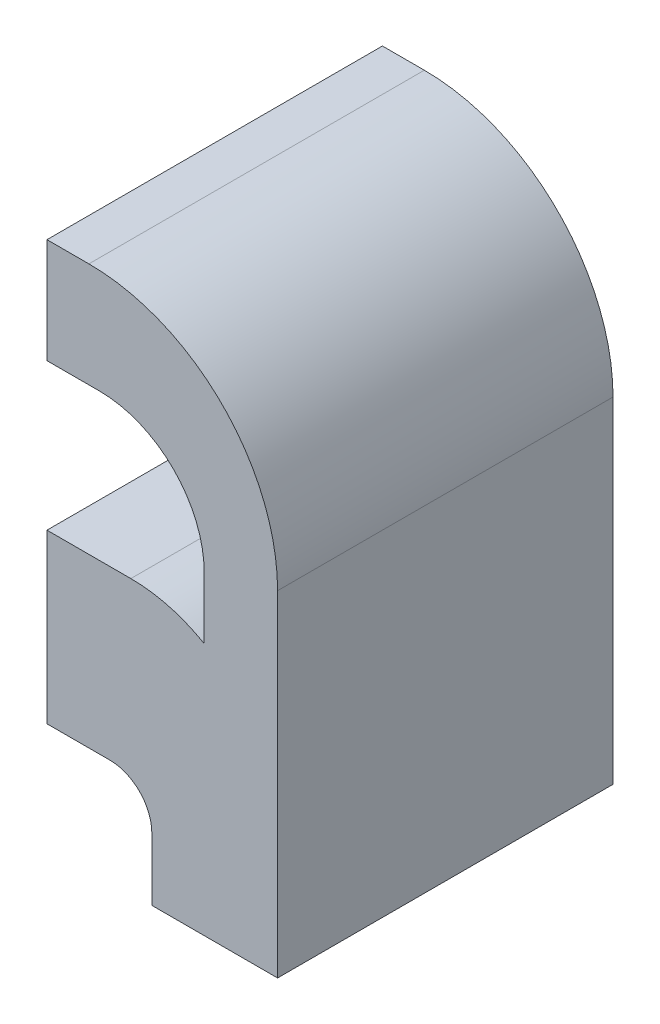
from build123d import *

# Parameters (mm, degrees)
BOSS_EXTRUDE1_DEPTH = 80
SKETCH2_R           = 2.5
CUT_EXTRUDE1_DEPTH  = 20
LPATTERN1_START     = -50
LPATTERN1_OUTLINE_R = 2.5
LPATTERN1_DEPTH     = 20
SKETCH3_W           = 154
SKETCH3_H           = 6
CUT_EXTRUDE2_DEPTH  = 20
LPATTERN2_COUNT     = 6
LPATTERN2_PITCH     = 7.6


# Read off the part's stored shape, not the designer's step: LPattern1
with BuildPart() as part:
    # Sketch1 → Boss-Extrude1 (new, symmetric)
    with BuildSketch(Plane.XY):
        with BuildLine():
            ThreePointArc((25, 120.621778265), (50.621778265, 95), (60, 60))
            Line((60, 60), (60, 160))
            ThreePointArc((60, 160), (33.639610307, 223.639610307), (-30, 250))
            Line((-30, 250), (-50, 250))
            Line((-50, 250), (-50, 200))
            Line((-50, 200), (-25, 200))
            ThreePointArc((-25, 200), (10.355339059, 185.355339059), (25, 150))
            Line((25, 150), (25, 120.621778265))
        make_face()
        with BuildLine():
            ThreePointArc((-10, 130), (39.497474683, 109.497474683), (60, 60))
            Line((60, 60), (60, 0))
            Line((60, 0), (0, 0))
            Line((0, 0), (0, 30))
            ThreePointArc((0, 30), (-5.857864376, 44.142135624), (-20, 50))
            Line((-20, 50), (-50, 50))
            Line((-50, 50), (-50, 130))
            Line((-50, 130), (-10, 130))
        make_face()
    extrude(amount=BOSS_EXTRUDE1_DEPTH, both=True)

    # Sketch2 → Cut-Extrude1 (cut)
    with BuildSketch(Plane.ZY.offset(50)):
        with Locations((-75, 125)):
            Circle(SKETCH2_R)
    extrude(amount=-CUT_EXTRUDE1_DEPTH, mode=Mode.SUBTRACT)

    # LPattern1 outline → LPattern1 (cut)
    with BuildSketch(Plane.YZ.offset(LPATTERN1_START)):
        with Locations((57, 73)):
            Circle(LPATTERN1_OUTLINE_R)
        with Locations((57, 66.565217391)):
            Circle(LPATTERN1_OUTLINE_R)
        with Locations((57, 60.130434783)):
            Circle(LPATTERN1_OUTLINE_R)
        with Locations((57, 53.695652174)):
            Circle(LPATTERN1_OUTLINE_R)
        with Locations((57, 47.260869565)):
            Circle(LPATTERN1_OUTLINE_R)
        with Locations((57, 40.826086957)):
            Circle(LPATTERN1_OUTLINE_R)
        with Locations((57, 34.391304348)):
            Circle(LPATTERN1_OUTLINE_R)
        with Locations((57, 27.956521739)):
            Circle(LPATTERN1_OUTLINE_R)
        with Locations((57, 21.52173913)):
            Circle(LPATTERN1_OUTLINE_R)
        with Locations((57, 15.086956522)):
            Circle(LPATTERN1_OUTLINE_R)
        with Locations((57, 8.652173913)):
            Circle(LPATTERN1_OUTLINE_R)
        with Locations((57, 2.217391304)):
            Circle(LPATTERN1_OUTLINE_R)
        with Locations((57, -4.217391304)):
            Circle(LPATTERN1_OUTLINE_R)
        with Locations((57, -10.652173913)):
            Circle(LPATTERN1_OUTLINE_R)
        with Locations((57, -17.086956522)):
            Circle(LPATTERN1_OUTLINE_R)
        with Locations((57, -23.52173913)):
            Circle(LPATTERN1_OUTLINE_R)
        with Locations((57, -29.956521739)):
            Circle(LPATTERN1_OUTLINE_R)
        with Locations((57, -36.391304348)):
            Circle(LPATTERN1_OUTLINE_R)
        with Locations((57, -42.826086957)):
            Circle(LPATTERN1_OUTLINE_R)
        with Locations((57, -49.260869565)):
            Circle(LPATTERN1_OUTLINE_R)
        with Locations((57, -55.695652174)):
            Circle(LPATTERN1_OUTLINE_R)
        with Locations((57, -62.130434783)):
            Circle(LPATTERN1_OUTLINE_R)
        with Locations((57, -68.565217391)):
            Circle(LPATTERN1_OUTLINE_R)
        with Locations((57, -75)):
            Circle(LPATTERN1_OUTLINE_R)
        with Locations((62.230769231, 73)):
            Circle(LPATTERN1_OUTLINE_R)
        with Locations((62.230769231, 66.565217391)):
            Circle(LPATTERN1_OUTLINE_R)
        with Locations((62.230769231, 60.130434783)):
            Circle(LPATTERN1_OUTLINE_R)
        with Locations((62.230769231, 53.695652174)):
            Circle(LPATTERN1_OUTLINE_R)
        with Locations((62.230769231, 47.260869565)):
            Circle(LPATTERN1_OUTLINE_R)
        with Locations((62.230769231, 40.826086957)):
            Circle(LPATTERN1_OUTLINE_R)
        with Locations((62.230769231, 34.391304348)):
            Circle(LPATTERN1_OUTLINE_R)
        with Locations((62.230769231, 27.956521739)):
            Circle(LPATTERN1_OUTLINE_R)
        with Locations((62.230769231, 21.52173913)):
            Circle(LPATTERN1_OUTLINE_R)
        with Locations((62.230769231, 15.086956522)):
            Circle(LPATTERN1_OUTLINE_R)
        with Locations((62.230769231, 8.652173913)):
            Circle(LPATTERN1_OUTLINE_R)
        with Locations((62.230769231, 2.217391304)):
            Circle(LPATTERN1_OUTLINE_R)
        with Locations((62.230769231, -4.217391304)):
            Circle(LPATTERN1_OUTLINE_R)
        with Locations((62.230769231, -10.652173913)):
            Circle(LPATTERN1_OUTLINE_R)
        with Locations((62.230769231, -17.086956522)):
            Circle(LPATTERN1_OUTLINE_R)
        with Locations((62.230769231, -23.52173913)):
            Circle(LPATTERN1_OUTLINE_R)
        with Locations((62.230769231, -29.956521739)):
            Circle(LPATTERN1_OUTLINE_R)
        with Locations((62.230769231, -36.391304348)):
            Circle(LPATTERN1_OUTLINE_R)
        with Locations((62.230769231, -42.826086957)):
            Circle(LPATTERN1_OUTLINE_R)
        with Locations((62.230769231, -49.260869565)):
            Circle(LPATTERN1_OUTLINE_R)
        with Locations((62.230769231, -55.695652174)):
            Circle(LPATTERN1_OUTLINE_R)
        with Locations((62.230769231, -62.130434783)):
            Circle(LPATTERN1_OUTLINE_R)
        with Locations((62.230769231, -68.565217391)):
            Circle(LPATTERN1_OUTLINE_R)
        with Locations((62.230769231, -75)):
            Circle(LPATTERN1_OUTLINE_R)
        with Locations((67.461538462, 73)):
            Circle(LPATTERN1_OUTLINE_R)
        with Locations((67.461538462, 66.565217391)):
            Circle(LPATTERN1_OUTLINE_R)
        with Locations((67.461538462, 60.130434783)):
            Circle(LPATTERN1_OUTLINE_R)
        with Locations((67.461538462, 53.695652174)):
            Circle(LPATTERN1_OUTLINE_R)
        with Locations((67.461538462, 47.260869565)):
            Circle(LPATTERN1_OUTLINE_R)
        with Locations((67.461538462, 40.826086957)):
            Circle(LPATTERN1_OUTLINE_R)
        with Locations((67.461538462, 34.391304348)):
            Circle(LPATTERN1_OUTLINE_R)
        with Locations((67.461538462, 27.956521739)):
            Circle(LPATTERN1_OUTLINE_R)
        with Locations((67.461538462, 21.52173913)):
            Circle(LPATTERN1_OUTLINE_R)
        with Locations((67.461538462, 15.086956522)):
            Circle(LPATTERN1_OUTLINE_R)
        with Locations((67.461538462, 8.652173913)):
            Circle(LPATTERN1_OUTLINE_R)
        with Locations((67.461538462, 2.217391304)):
            Circle(LPATTERN1_OUTLINE_R)
        with Locations((67.461538462, -4.217391304)):
            Circle(LPATTERN1_OUTLINE_R)
        with Locations((67.461538462, -10.652173913)):
            Circle(LPATTERN1_OUTLINE_R)
        with Locations((67.461538462, -17.086956522)):
            Circle(LPATTERN1_OUTLINE_R)
        with Locations((67.461538462, -23.52173913)):
            Circle(LPATTERN1_OUTLINE_R)
        with Locations((67.461538462, -29.956521739)):
            Circle(LPATTERN1_OUTLINE_R)
        with Locations((67.461538462, -36.391304348)):
            Circle(LPATTERN1_OUTLINE_R)
        with Locations((67.461538462, -42.826086957)):
            Circle(LPATTERN1_OUTLINE_R)
        with Locations((67.461538462, -49.260869565)):
            Circle(LPATTERN1_OUTLINE_R)
        with Locations((67.461538462, -55.695652174)):
            Circle(LPATTERN1_OUTLINE_R)
        with Locations((67.461538462, -62.130434783)):
            Circle(LPATTERN1_OUTLINE_R)
        with Locations((67.461538462, -68.565217391)):
            Circle(LPATTERN1_OUTLINE_R)
        with Locations((67.461538462, -75)):
            Circle(LPATTERN1_OUTLINE_R)
        with Locations((72.692307692, 73)):
            Circle(LPATTERN1_OUTLINE_R)
        with Locations((72.692307692, 66.565217391)):
            Circle(LPATTERN1_OUTLINE_R)
        with Locations((72.692307692, 60.130434783)):
            Circle(LPATTERN1_OUTLINE_R)
        with Locations((72.692307692, 53.695652174)):
            Circle(LPATTERN1_OUTLINE_R)
        with Locations((72.692307692, 47.260869565)):
            Circle(LPATTERN1_OUTLINE_R)
        with Locations((72.692307692, 40.826086957)):
            Circle(LPATTERN1_OUTLINE_R)
        with Locations((72.692307692, 34.391304348)):
            Circle(LPATTERN1_OUTLINE_R)
        with Locations((72.692307692, 27.956521739)):
            Circle(LPATTERN1_OUTLINE_R)
        with Locations((72.692307692, 21.52173913)):
            Circle(LPATTERN1_OUTLINE_R)
        with Locations((72.692307692, 15.086956522)):
            Circle(LPATTERN1_OUTLINE_R)
        with Locations((72.692307692, 8.652173913)):
            Circle(LPATTERN1_OUTLINE_R)
        with Locations((72.692307692, 2.217391304)):
            Circle(LPATTERN1_OUTLINE_R)
        with Locations((72.692307692, -4.217391304)):
            Circle(LPATTERN1_OUTLINE_R)
        with Locations((72.692307692, -10.652173913)):
            Circle(LPATTERN1_OUTLINE_R)
        with Locations((72.692307692, -17.086956522)):
            Circle(LPATTERN1_OUTLINE_R)
        with Locations((72.692307692, -23.52173913)):
            Circle(LPATTERN1_OUTLINE_R)
        with Locations((72.692307692, -29.956521739)):
            Circle(LPATTERN1_OUTLINE_R)
        with Locations((72.692307692, -36.391304348)):
            Circle(LPATTERN1_OUTLINE_R)
        with Locations((72.692307692, -42.826086957)):
            Circle(LPATTERN1_OUTLINE_R)
        with Locations((72.692307692, -49.260869565)):
            Circle(LPATTERN1_OUTLINE_R)
        with Locations((72.692307692, -55.695652174)):
            Circle(LPATTERN1_OUTLINE_R)
        with Locations((72.692307692, -62.130434783)):
            Circle(LPATTERN1_OUTLINE_R)
        with Locations((72.692307692, -68.565217391)):
            Circle(LPATTERN1_OUTLINE_R)
        with Locations((72.692307692, -75)):
            Circle(LPATTERN1_OUTLINE_R)
        with Locations((77.923076923, 73)):
            Circle(LPATTERN1_OUTLINE_R)
        with Locations((77.923076923, 66.565217391)):
            Circle(LPATTERN1_OUTLINE_R)
        with Locations((77.923076923, 60.130434783)):
            Circle(LPATTERN1_OUTLINE_R)
        with Locations((77.923076923, 53.695652174)):
            Circle(LPATTERN1_OUTLINE_R)
        with Locations((77.923076923, 47.260869565)):
            Circle(LPATTERN1_OUTLINE_R)
        with Locations((77.923076923, 40.826086957)):
            Circle(LPATTERN1_OUTLINE_R)
        with Locations((77.923076923, 34.391304348)):
            Circle(LPATTERN1_OUTLINE_R)
        with Locations((77.923076923, 27.956521739)):
            Circle(LPATTERN1_OUTLINE_R)
        with Locations((77.923076923, 21.52173913)):
            Circle(LPATTERN1_OUTLINE_R)
        with Locations((77.923076923, 15.086956522)):
            Circle(LPATTERN1_OUTLINE_R)
        with Locations((77.923076923, 8.652173913)):
            Circle(LPATTERN1_OUTLINE_R)
        with Locations((77.923076923, 2.217391304)):
            Circle(LPATTERN1_OUTLINE_R)
        with Locations((77.923076923, -4.217391304)):
            Circle(LPATTERN1_OUTLINE_R)
        with Locations((77.923076923, -10.652173913)):
            Circle(LPATTERN1_OUTLINE_R)
        with Locations((77.923076923, -17.086956522)):
            Circle(LPATTERN1_OUTLINE_R)
        with Locations((77.923076923, -23.52173913)):
            Circle(LPATTERN1_OUTLINE_R)
        with Locations((77.923076923, -29.956521739)):
            Circle(LPATTERN1_OUTLINE_R)
        with Locations((77.923076923, -36.391304348)):
            Circle(LPATTERN1_OUTLINE_R)
        with Locations((77.923076923, -42.826086957)):
            Circle(LPATTERN1_OUTLINE_R)
        with Locations((77.923076923, -49.260869565)):
            Circle(LPATTERN1_OUTLINE_R)
        with Locations((77.923076923, -55.695652174)):
            Circle(LPATTERN1_OUTLINE_R)
        with Locations((77.923076923, -62.130434783)):
            Circle(LPATTERN1_OUTLINE_R)
        with Locations((77.923076923, -68.565217391)):
            Circle(LPATTERN1_OUTLINE_R)
        with Locations((77.923076923, -75)):
            Circle(LPATTERN1_OUTLINE_R)
        with Locations((83.153846154, 73)):
            Circle(LPATTERN1_OUTLINE_R)
        with Locations((83.153846154, 66.565217391)):
            Circle(LPATTERN1_OUTLINE_R)
        with Locations((83.153846154, 60.130434783)):
            Circle(LPATTERN1_OUTLINE_R)
        with Locations((83.153846154, 53.695652174)):
            Circle(LPATTERN1_OUTLINE_R)
        with Locations((83.153846154, 47.260869565)):
            Circle(LPATTERN1_OUTLINE_R)
        with Locations((83.153846154, 40.826086957)):
            Circle(LPATTERN1_OUTLINE_R)
        with Locations((83.153846154, 34.391304348)):
            Circle(LPATTERN1_OUTLINE_R)
        with Locations((83.153846154, 27.956521739)):
            Circle(LPATTERN1_OUTLINE_R)
        with Locations((83.153846154, 21.52173913)):
            Circle(LPATTERN1_OUTLINE_R)
        with Locations((83.153846154, 15.086956522)):
            Circle(LPATTERN1_OUTLINE_R)
        with Locations((83.153846154, 8.652173913)):
            Circle(LPATTERN1_OUTLINE_R)
        with Locations((83.153846154, 2.217391304)):
            Circle(LPATTERN1_OUTLINE_R)
        with Locations((83.153846154, -4.217391304)):
            Circle(LPATTERN1_OUTLINE_R)
        with Locations((83.153846154, -10.652173913)):
            Circle(LPATTERN1_OUTLINE_R)
        with Locations((83.153846154, -17.086956522)):
            Circle(LPATTERN1_OUTLINE_R)
        with Locations((83.153846154, -23.52173913)):
            Circle(LPATTERN1_OUTLINE_R)
        with Locations((83.153846154, -29.956521739)):
            Circle(LPATTERN1_OUTLINE_R)
        with Locations((83.153846154, -36.391304348)):
            Circle(LPATTERN1_OUTLINE_R)
        with Locations((83.153846154, -42.826086957)):
            Circle(LPATTERN1_OUTLINE_R)
        with Locations((83.153846154, -49.260869565)):
            Circle(LPATTERN1_OUTLINE_R)
        with Locations((83.153846154, -55.695652174)):
            Circle(LPATTERN1_OUTLINE_R)
        with Locations((83.153846154, -62.130434783)):
            Circle(LPATTERN1_OUTLINE_R)
        with Locations((83.153846154, -68.565217391)):
            Circle(LPATTERN1_OUTLINE_R)
        with Locations((83.153846154, -75)):
            Circle(LPATTERN1_OUTLINE_R)
        with Locations((88.384615385, 73)):
            Circle(LPATTERN1_OUTLINE_R)
        with Locations((88.384615385, 66.565217391)):
            Circle(LPATTERN1_OUTLINE_R)
        with Locations((88.384615385, 60.130434783)):
            Circle(LPATTERN1_OUTLINE_R)
        with Locations((88.384615385, 53.695652174)):
            Circle(LPATTERN1_OUTLINE_R)
        with Locations((88.384615385, 47.260869565)):
            Circle(LPATTERN1_OUTLINE_R)
        with Locations((88.384615385, 40.826086957)):
            Circle(LPATTERN1_OUTLINE_R)
        with Locations((88.384615385, 34.391304348)):
            Circle(LPATTERN1_OUTLINE_R)
        with Locations((88.384615385, 27.956521739)):
            Circle(LPATTERN1_OUTLINE_R)
        with Locations((88.384615385, 21.52173913)):
            Circle(LPATTERN1_OUTLINE_R)
        with Locations((88.384615385, 15.086956522)):
            Circle(LPATTERN1_OUTLINE_R)
        with Locations((88.384615385, 8.652173913)):
            Circle(LPATTERN1_OUTLINE_R)
        with Locations((88.384615385, 2.217391304)):
            Circle(LPATTERN1_OUTLINE_R)
        with Locations((88.384615385, -4.217391304)):
            Circle(LPATTERN1_OUTLINE_R)
        with Locations((88.384615385, -10.652173913)):
            Circle(LPATTERN1_OUTLINE_R)
        with Locations((88.384615385, -17.086956522)):
            Circle(LPATTERN1_OUTLINE_R)
        with Locations((88.384615385, -23.52173913)):
            Circle(LPATTERN1_OUTLINE_R)
        with Locations((88.384615385, -29.956521739)):
            Circle(LPATTERN1_OUTLINE_R)
        with Locations((88.384615385, -36.391304348)):
            Circle(LPATTERN1_OUTLINE_R)
        with Locations((88.384615385, -42.826086957)):
            Circle(LPATTERN1_OUTLINE_R)
        with Locations((88.384615385, -49.260869565)):
            Circle(LPATTERN1_OUTLINE_R)
        with Locations((88.384615385, -55.695652174)):
            Circle(LPATTERN1_OUTLINE_R)
        with Locations((88.384615385, -62.130434783)):
            Circle(LPATTERN1_OUTLINE_R)
        with Locations((88.384615385, -68.565217391)):
            Circle(LPATTERN1_OUTLINE_R)
        with Locations((88.384615385, -75)):
            Circle(LPATTERN1_OUTLINE_R)
        with Locations((93.615384615, 73)):
            Circle(LPATTERN1_OUTLINE_R)
        with Locations((93.615384615, 66.565217391)):
            Circle(LPATTERN1_OUTLINE_R)
        with Locations((93.615384615, 60.130434783)):
            Circle(LPATTERN1_OUTLINE_R)
        with Locations((93.615384615, 53.695652174)):
            Circle(LPATTERN1_OUTLINE_R)
        with Locations((93.615384615, 47.260869565)):
            Circle(LPATTERN1_OUTLINE_R)
        with Locations((93.615384615, 40.826086957)):
            Circle(LPATTERN1_OUTLINE_R)
        with Locations((93.615384615, 34.391304348)):
            Circle(LPATTERN1_OUTLINE_R)
        with Locations((93.615384615, 27.956521739)):
            Circle(LPATTERN1_OUTLINE_R)
        with Locations((93.615384615, 21.52173913)):
            Circle(LPATTERN1_OUTLINE_R)
        with Locations((93.615384615, 15.086956522)):
            Circle(LPATTERN1_OUTLINE_R)
        with Locations((93.615384615, 8.652173913)):
            Circle(LPATTERN1_OUTLINE_R)
        with Locations((93.615384615, 2.217391304)):
            Circle(LPATTERN1_OUTLINE_R)
        with Locations((93.615384615, -4.217391304)):
            Circle(LPATTERN1_OUTLINE_R)
        with Locations((93.615384615, -10.652173913)):
            Circle(LPATTERN1_OUTLINE_R)
        with Locations((93.615384615, -17.086956522)):
            Circle(LPATTERN1_OUTLINE_R)
        with Locations((93.615384615, -23.52173913)):
            Circle(LPATTERN1_OUTLINE_R)
        with Locations((93.615384615, -29.956521739)):
            Circle(LPATTERN1_OUTLINE_R)
        with Locations((93.615384615, -36.391304348)):
            Circle(LPATTERN1_OUTLINE_R)
        with Locations((93.615384615, -42.826086957)):
            Circle(LPATTERN1_OUTLINE_R)
        with Locations((93.615384615, -49.260869565)):
            Circle(LPATTERN1_OUTLINE_R)
        with Locations((93.615384615, -55.695652174)):
            Circle(LPATTERN1_OUTLINE_R)
        with Locations((93.615384615, -62.130434783)):
            Circle(LPATTERN1_OUTLINE_R)
        with Locations((93.615384615, -68.565217391)):
            Circle(LPATTERN1_OUTLINE_R)
        with Locations((93.615384615, -75)):
            Circle(LPATTERN1_OUTLINE_R)
        with Locations((98.846153846, 73)):
            Circle(LPATTERN1_OUTLINE_R)
        with Locations((98.846153846, 66.565217391)):
            Circle(LPATTERN1_OUTLINE_R)
        with Locations((98.846153846, 60.130434783)):
            Circle(LPATTERN1_OUTLINE_R)
        with Locations((98.846153846, 53.695652174)):
            Circle(LPATTERN1_OUTLINE_R)
        with Locations((98.846153846, 47.260869565)):
            Circle(LPATTERN1_OUTLINE_R)
        with Locations((98.846153846, 40.826086957)):
            Circle(LPATTERN1_OUTLINE_R)
        with Locations((98.846153846, 34.391304348)):
            Circle(LPATTERN1_OUTLINE_R)
        with Locations((98.846153846, 27.956521739)):
            Circle(LPATTERN1_OUTLINE_R)
        with Locations((98.846153846, 21.52173913)):
            Circle(LPATTERN1_OUTLINE_R)
        with Locations((98.846153846, 15.086956522)):
            Circle(LPATTERN1_OUTLINE_R)
        with Locations((98.846153846, 8.652173913)):
            Circle(LPATTERN1_OUTLINE_R)
        with Locations((98.846153846, 2.217391304)):
            Circle(LPATTERN1_OUTLINE_R)
        with Locations((98.846153846, -4.217391304)):
            Circle(LPATTERN1_OUTLINE_R)
        with Locations((98.846153846, -10.652173913)):
            Circle(LPATTERN1_OUTLINE_R)
        with Locations((98.846153846, -17.086956522)):
            Circle(LPATTERN1_OUTLINE_R)
        with Locations((98.846153846, -23.52173913)):
            Circle(LPATTERN1_OUTLINE_R)
        with Locations((98.846153846, -29.956521739)):
            Circle(LPATTERN1_OUTLINE_R)
        with Locations((98.846153846, -36.391304348)):
            Circle(LPATTERN1_OUTLINE_R)
        with Locations((98.846153846, -42.826086957)):
            Circle(LPATTERN1_OUTLINE_R)
        with Locations((98.846153846, -49.260869565)):
            Circle(LPATTERN1_OUTLINE_R)
        with Locations((98.846153846, -55.695652174)):
            Circle(LPATTERN1_OUTLINE_R)
        with Locations((98.846153846, -62.130434783)):
            Circle(LPATTERN1_OUTLINE_R)
        with Locations((98.846153846, -68.565217391)):
            Circle(LPATTERN1_OUTLINE_R)
        with Locations((98.846153846, -75)):
            Circle(LPATTERN1_OUTLINE_R)
        with Locations((104.076923077, 73)):
            Circle(LPATTERN1_OUTLINE_R)
        with Locations((104.076923077, 66.565217391)):
            Circle(LPATTERN1_OUTLINE_R)
        with Locations((104.076923077, 60.130434783)):
            Circle(LPATTERN1_OUTLINE_R)
        with Locations((104.076923077, 53.695652174)):
            Circle(LPATTERN1_OUTLINE_R)
        with Locations((104.076923077, 47.260869565)):
            Circle(LPATTERN1_OUTLINE_R)
        with Locations((104.076923077, 40.826086957)):
            Circle(LPATTERN1_OUTLINE_R)
        with Locations((104.076923077, 34.391304348)):
            Circle(LPATTERN1_OUTLINE_R)
        with Locations((104.076923077, 27.956521739)):
            Circle(LPATTERN1_OUTLINE_R)
        with Locations((104.076923077, 21.52173913)):
            Circle(LPATTERN1_OUTLINE_R)
        with Locations((104.076923077, 15.086956522)):
            Circle(LPATTERN1_OUTLINE_R)
        with Locations((104.076923077, 8.652173913)):
            Circle(LPATTERN1_OUTLINE_R)
        with Locations((104.076923077, 2.217391304)):
            Circle(LPATTERN1_OUTLINE_R)
        with Locations((104.076923077, -4.217391304)):
            Circle(LPATTERN1_OUTLINE_R)
        with Locations((104.076923077, -10.652173913)):
            Circle(LPATTERN1_OUTLINE_R)
        with Locations((104.076923077, -17.086956522)):
            Circle(LPATTERN1_OUTLINE_R)
        with Locations((104.076923077, -23.52173913)):
            Circle(LPATTERN1_OUTLINE_R)
        with Locations((104.076923077, -29.956521739)):
            Circle(LPATTERN1_OUTLINE_R)
        with Locations((104.076923077, -36.391304348)):
            Circle(LPATTERN1_OUTLINE_R)
        with Locations((104.076923077, -42.826086957)):
            Circle(LPATTERN1_OUTLINE_R)
        with Locations((104.076923077, -49.260869565)):
            Circle(LPATTERN1_OUTLINE_R)
        with Locations((104.076923077, -55.695652174)):
            Circle(LPATTERN1_OUTLINE_R)
        with Locations((104.076923077, -62.130434783)):
            Circle(LPATTERN1_OUTLINE_R)
        with Locations((104.076923077, -68.565217391)):
            Circle(LPATTERN1_OUTLINE_R)
        with Locations((104.076923077, -75)):
            Circle(LPATTERN1_OUTLINE_R)
        with Locations((109.307692308, 73)):
            Circle(LPATTERN1_OUTLINE_R)
        with Locations((109.307692308, 66.565217391)):
            Circle(LPATTERN1_OUTLINE_R)
        with Locations((109.307692308, 60.130434783)):
            Circle(LPATTERN1_OUTLINE_R)
        with Locations((109.307692308, 53.695652174)):
            Circle(LPATTERN1_OUTLINE_R)
        with Locations((109.307692308, 47.260869565)):
            Circle(LPATTERN1_OUTLINE_R)
        with Locations((109.307692308, 40.826086957)):
            Circle(LPATTERN1_OUTLINE_R)
        with Locations((109.307692308, 34.391304348)):
            Circle(LPATTERN1_OUTLINE_R)
        with Locations((109.307692308, 27.956521739)):
            Circle(LPATTERN1_OUTLINE_R)
        with Locations((109.307692308, 21.52173913)):
            Circle(LPATTERN1_OUTLINE_R)
        with Locations((109.307692308, 15.086956522)):
            Circle(LPATTERN1_OUTLINE_R)
        with Locations((109.307692308, 8.652173913)):
            Circle(LPATTERN1_OUTLINE_R)
        with Locations((109.307692308, 2.217391304)):
            Circle(LPATTERN1_OUTLINE_R)
        with Locations((109.307692308, -4.217391304)):
            Circle(LPATTERN1_OUTLINE_R)
        with Locations((109.307692308, -10.652173913)):
            Circle(LPATTERN1_OUTLINE_R)
        with Locations((109.307692308, -17.086956522)):
            Circle(LPATTERN1_OUTLINE_R)
        with Locations((109.307692308, -23.52173913)):
            Circle(LPATTERN1_OUTLINE_R)
        with Locations((109.307692308, -29.956521739)):
            Circle(LPATTERN1_OUTLINE_R)
        with Locations((109.307692308, -36.391304348)):
            Circle(LPATTERN1_OUTLINE_R)
        with Locations((109.307692308, -42.826086957)):
            Circle(LPATTERN1_OUTLINE_R)
        with Locations((109.307692308, -49.260869565)):
            Circle(LPATTERN1_OUTLINE_R)
        with Locations((109.307692308, -55.695652174)):
            Circle(LPATTERN1_OUTLINE_R)
        with Locations((109.307692308, -62.130434783)):
            Circle(LPATTERN1_OUTLINE_R)
        with Locations((109.307692308, -68.565217391)):
            Circle(LPATTERN1_OUTLINE_R)
        with Locations((109.307692308, -75)):
            Circle(LPATTERN1_OUTLINE_R)
        with Locations((114.538461538, 73)):
            Circle(LPATTERN1_OUTLINE_R)
        with Locations((114.538461538, 66.565217391)):
            Circle(LPATTERN1_OUTLINE_R)
        with Locations((114.538461538, 60.130434783)):
            Circle(LPATTERN1_OUTLINE_R)
        with Locations((114.538461538, 53.695652174)):
            Circle(LPATTERN1_OUTLINE_R)
        with Locations((114.538461538, 47.260869565)):
            Circle(LPATTERN1_OUTLINE_R)
        with Locations((114.538461538, 40.826086957)):
            Circle(LPATTERN1_OUTLINE_R)
        with Locations((114.538461538, 34.391304348)):
            Circle(LPATTERN1_OUTLINE_R)
        with Locations((114.538461538, 27.956521739)):
            Circle(LPATTERN1_OUTLINE_R)
        with Locations((114.538461538, 21.52173913)):
            Circle(LPATTERN1_OUTLINE_R)
        with Locations((114.538461538, 15.086956522)):
            Circle(LPATTERN1_OUTLINE_R)
        with Locations((114.538461538, 8.652173913)):
            Circle(LPATTERN1_OUTLINE_R)
        with Locations((114.538461538, 2.217391304)):
            Circle(LPATTERN1_OUTLINE_R)
        with Locations((114.538461538, -4.217391304)):
            Circle(LPATTERN1_OUTLINE_R)
        with Locations((114.538461538, -10.652173913)):
            Circle(LPATTERN1_OUTLINE_R)
        with Locations((114.538461538, -17.086956522)):
            Circle(LPATTERN1_OUTLINE_R)
        with Locations((114.538461538, -23.52173913)):
            Circle(LPATTERN1_OUTLINE_R)
        with Locations((114.538461538, -29.956521739)):
            Circle(LPATTERN1_OUTLINE_R)
        with Locations((114.538461538, -36.391304348)):
            Circle(LPATTERN1_OUTLINE_R)
        with Locations((114.538461538, -42.826086957)):
            Circle(LPATTERN1_OUTLINE_R)
        with Locations((114.538461538, -49.260869565)):
            Circle(LPATTERN1_OUTLINE_R)
        with Locations((114.538461538, -55.695652174)):
            Circle(LPATTERN1_OUTLINE_R)
        with Locations((114.538461538, -62.130434783)):
            Circle(LPATTERN1_OUTLINE_R)
        with Locations((114.538461538, -68.565217391)):
            Circle(LPATTERN1_OUTLINE_R)
        with Locations((114.538461538, -75)):
            Circle(LPATTERN1_OUTLINE_R)
        with Locations((119.769230769, 73)):
            Circle(LPATTERN1_OUTLINE_R)
        with Locations((119.769230769, 66.565217391)):
            Circle(LPATTERN1_OUTLINE_R)
        with Locations((119.769230769, 60.130434783)):
            Circle(LPATTERN1_OUTLINE_R)
        with Locations((119.769230769, 53.695652174)):
            Circle(LPATTERN1_OUTLINE_R)
        with Locations((119.769230769, 47.260869565)):
            Circle(LPATTERN1_OUTLINE_R)
        with Locations((119.769230769, 40.826086957)):
            Circle(LPATTERN1_OUTLINE_R)
        with Locations((119.769230769, 34.391304348)):
            Circle(LPATTERN1_OUTLINE_R)
        with Locations((119.769230769, 27.956521739)):
            Circle(LPATTERN1_OUTLINE_R)
        with Locations((119.769230769, 21.52173913)):
            Circle(LPATTERN1_OUTLINE_R)
        with Locations((119.769230769, 15.086956522)):
            Circle(LPATTERN1_OUTLINE_R)
        with Locations((119.769230769, 8.652173913)):
            Circle(LPATTERN1_OUTLINE_R)
        with Locations((119.769230769, 2.217391304)):
            Circle(LPATTERN1_OUTLINE_R)
        with Locations((119.769230769, -4.217391304)):
            Circle(LPATTERN1_OUTLINE_R)
        with Locations((119.769230769, -10.652173913)):
            Circle(LPATTERN1_OUTLINE_R)
        with Locations((119.769230769, -17.086956522)):
            Circle(LPATTERN1_OUTLINE_R)
        with Locations((119.769230769, -23.52173913)):
            Circle(LPATTERN1_OUTLINE_R)
        with Locations((119.769230769, -29.956521739)):
            Circle(LPATTERN1_OUTLINE_R)
        with Locations((119.769230769, -36.391304348)):
            Circle(LPATTERN1_OUTLINE_R)
        with Locations((119.769230769, -42.826086957)):
            Circle(LPATTERN1_OUTLINE_R)
        with Locations((119.769230769, -49.260869565)):
            Circle(LPATTERN1_OUTLINE_R)
        with Locations((119.769230769, -55.695652174)):
            Circle(LPATTERN1_OUTLINE_R)
        with Locations((119.769230769, -62.130434783)):
            Circle(LPATTERN1_OUTLINE_R)
        with Locations((119.769230769, -68.565217391)):
            Circle(LPATTERN1_OUTLINE_R)
        with Locations((119.769230769, -75)):
            Circle(LPATTERN1_OUTLINE_R)
        with Locations((125, 73)):
            Circle(LPATTERN1_OUTLINE_R)
        with Locations((125, 66.565217391)):
            Circle(LPATTERN1_OUTLINE_R)
        with Locations((125, 60.130434783)):
            Circle(LPATTERN1_OUTLINE_R)
        with Locations((125, 53.695652174)):
            Circle(LPATTERN1_OUTLINE_R)
        with Locations((125, 47.260869565)):
            Circle(LPATTERN1_OUTLINE_R)
        with Locations((125, 40.826086957)):
            Circle(LPATTERN1_OUTLINE_R)
        with Locations((125, 34.391304348)):
            Circle(LPATTERN1_OUTLINE_R)
        with Locations((125, 27.956521739)):
            Circle(LPATTERN1_OUTLINE_R)
        with Locations((125, 21.52173913)):
            Circle(LPATTERN1_OUTLINE_R)
        with Locations((125, 15.086956522)):
            Circle(LPATTERN1_OUTLINE_R)
        with Locations((125, 8.652173913)):
            Circle(LPATTERN1_OUTLINE_R)
        with Locations((125, 2.217391304)):
            Circle(LPATTERN1_OUTLINE_R)
        with Locations((125, -4.217391304)):
            Circle(LPATTERN1_OUTLINE_R)
        with Locations((125, -10.652173913)):
            Circle(LPATTERN1_OUTLINE_R)
        with Locations((125, -17.086956522)):
            Circle(LPATTERN1_OUTLINE_R)
        with Locations((125, -23.52173913)):
            Circle(LPATTERN1_OUTLINE_R)
        with Locations((125, -29.956521739)):
            Circle(LPATTERN1_OUTLINE_R)
        with Locations((125, -36.391304348)):
            Circle(LPATTERN1_OUTLINE_R)
        with Locations((125, -42.826086957)):
            Circle(LPATTERN1_OUTLINE_R)
        with Locations((125, -49.260869565)):
            Circle(LPATTERN1_OUTLINE_R)
        with Locations((125, -55.695652174)):
            Circle(LPATTERN1_OUTLINE_R)
        with Locations((125, -62.130434783)):
            Circle(LPATTERN1_OUTLINE_R)
        with Locations((125, -68.565217391)):
            Circle(LPATTERN1_OUTLINE_R)
    extrude(amount=LPATTERN1_DEPTH, mode=Mode.SUBTRACT)

    # Sketch3 → Cut-Extrude2 (cut)
    with BuildSketch(Plane.ZY.offset(50)):
        with Locations((0, 244)):
            Rectangle(SKETCH3_W, SKETCH3_H)
    cut_extrude2 = extrude(amount=-CUT_EXTRUDE2_DEPTH, mode=Mode.SUBTRACT)

    # LPattern2: Cut-Extrude2 ×6
    with Locations(*[(0, -i * LPATTERN2_PITCH, 0) for i in range(1, LPATTERN2_COUNT)]):
        add(cut_extrude2, mode=Mode.SUBTRACT)


solid = part.part
